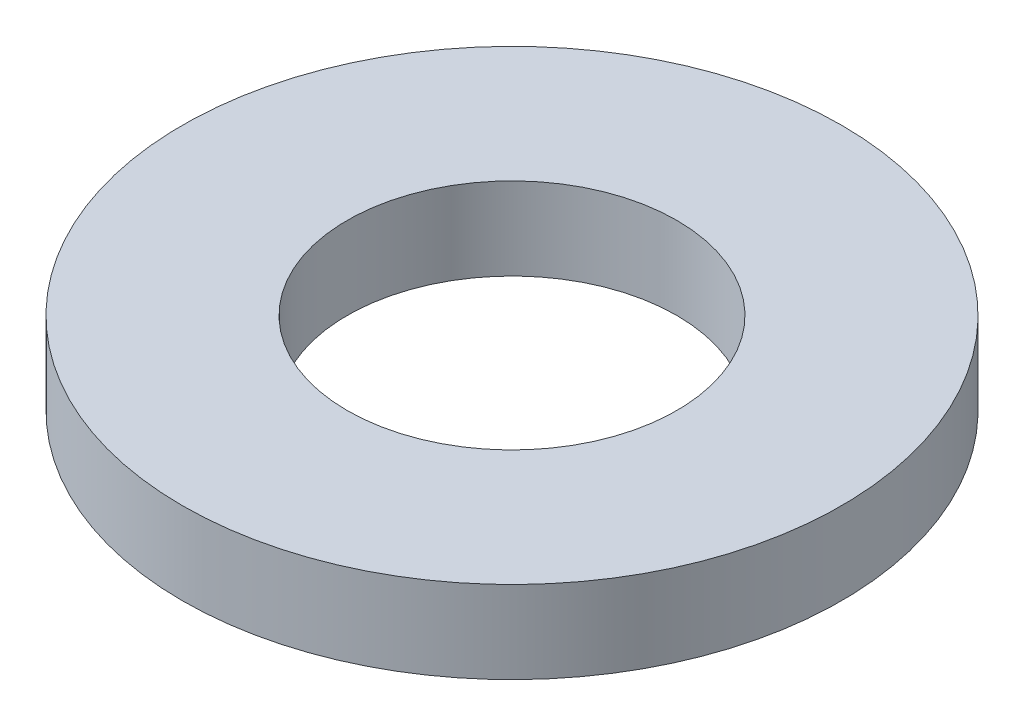
from build123d import *

# Parameters (mm, degrees)
SKETCH1_R           = 40
BOSS_EXTRUDE1_DEPTH = 10
SKETCH2_R           = 20
CUT_EXTRUDE1_DEPTH  = 58.445626465


with BuildPart() as part:
    # Sketch1 → Boss-Extrude1 (new body)
    with BuildSketch(Plane(origin=(0, 0, 0), x_dir=(1, 0, 0), z_dir=(0, 1, 0))):
        Circle(SKETCH1_R)
    extrude(amount=BOSS_EXTRUDE1_DEPTH)

    # Sketch2 → Cut-Extrude1 (cut, through all)
    with BuildSketch(Plane(origin=(0, 0, 0), x_dir=(1, 0, 0), z_dir=(0, 1, 0))):
        Circle(SKETCH2_R)
    extrude(amount=CUT_EXTRUDE1_DEPTH, mode=Mode.SUBTRACT)


solid = part.part
